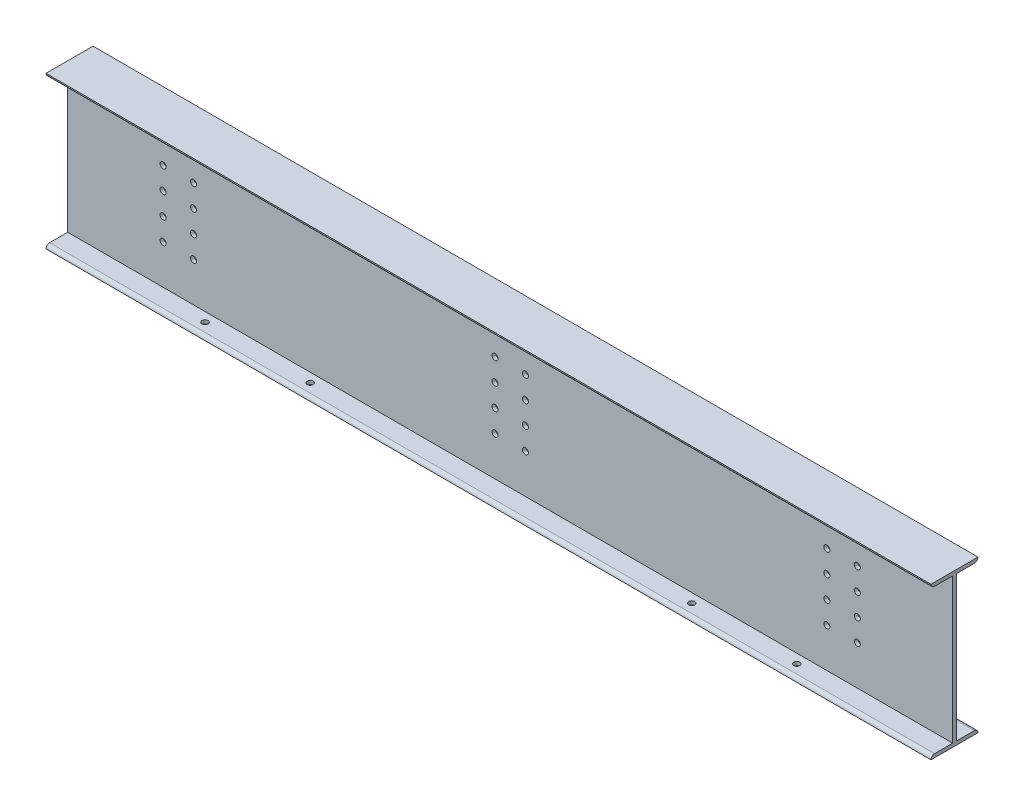
from build123d import *

# Parameters (mm, degrees)
SKETCH_1_W                        = 3200
SKETCH_1_H                        = 550
EXTRUDE_1_DEPTH                   = 170
SKETCH_2_R                        = 11
CUT_EXTRUDE_1_DEPTH               = 3252.368942461
PATTERN_LINEAR_1_COUNT            = 4
PATTERN_LINEAR_1_PITCH            = 80
PATTERN_LINEAR_1_COUNT_DIR2       = 2
PATTERN_LINEAR_1_PITCH_DIR2       = 110
PATTERN_LINEAR_2_COUNT            = 3
PATTERN_LINEAR_2_PITCH            = 1200
PATTERN_LINEAR_2_COPY_1_SKETCH_R  = 11
PATTERN_LINEAR_2_COPY_1_DEPTH     = 3252.368942461
PATTERN_LINEAR_2_COPY_2_SKETCH_R  = 11
PATTERN_LINEAR_2_COPY_2_DEPTH     = 3252.368942461
PATTERN_LINEAR_2_COPY_3_SKETCH_R  = 11
PATTERN_LINEAR_2_COPY_3_DEPTH     = 3252.368942461
PATTERN_LINEAR_2_COPY_4_SKETCH_R  = 11
PATTERN_LINEAR_2_COPY_4_DEPTH     = 3252.368942461
PATTERN_LINEAR_2_COPY_5_SKETCH_R  = 11
PATTERN_LINEAR_2_COPY_5_DEPTH     = 3252.368942461
PATTERN_LINEAR_2_COPY_6_SKETCH_R  = 11
PATTERN_LINEAR_2_COPY_6_DEPTH     = 3252.368942461
PATTERN_LINEAR_2_COPY_7_SKETCH_R  = 11
PATTERN_LINEAR_2_COPY_7_DEPTH     = 3252.368942461
PATTERN_LINEAR_2_COPY_8_SKETCH_R  = 11
PATTERN_LINEAR_2_COPY_8_DEPTH     = 3252.368942461
PATTERN_LINEAR_2_COPY_9_SKETCH_R  = 11
PATTERN_LINEAR_2_COPY_9_DEPTH     = 3252.368942461
PATTERN_LINEAR_2_COPY_10_SKETCH_R = 11
PATTERN_LINEAR_2_COPY_10_DEPTH    = 3252.368942461
PATTERN_LINEAR_2_COPY_11_SKETCH_R = 11
PATTERN_LINEAR_2_COPY_11_DEPTH    = 3252.368942461
PATTERN_LINEAR_2_COPY_12_SKETCH_R = 11
PATTERN_LINEAR_2_COPY_12_DEPTH    = 3252.368942461
PATTERN_LINEAR_2_COPY_13_SKETCH_R = 11
PATTERN_LINEAR_2_COPY_13_DEPTH    = 3252.368942461
PATTERN_LINEAR_2_COPY_14_SKETCH_R = 11
PATTERN_LINEAR_2_COPY_14_DEPTH    = 3252.368942461
SKETCH_3_R                        = 11
CUT_EXTRUDE_3_DEPTH               = 200
PATTERN_LINEAR_3_COUNT            = 2
PATTERN_LINEAR_3_PITCH            = 80
PATTERN_LINEAR_4_COUNT            = 2
PATTERN_LINEAR_4_PITCH            = 380
PATTERN_LINEAR_4_COPY_1_SKETCH_R  = 11
PATTERN_LINEAR_4_COPY_1_DEPTH     = 200
PATTERN_LINEAR_5_COUNT            = 2
PATTERN_LINEAR_5_PITCH            = 1760
PATTERN_LINEAR_5_COPY_1_SKETCH_R  = 11
PATTERN_LINEAR_5_COPY_1_DEPTH     = 200
PATTERN_LINEAR_5_COPY_2_SKETCH_R  = 11
PATTERN_LINEAR_5_COPY_2_DEPTH     = 200
PATTERN_LINEAR_5_COPY_3_SKETCH_R  = 11
PATTERN_LINEAR_5_COPY_3_DEPTH     = 200
SKETCH_4_W                        = 78.5
SKETCH_4_H                        = 524
CUT_EXTRUDE_4_DEPTH               = 3252.368942461
FILLET_1_R                        = 13
FILLET_2_R                        = 13
FILLET_3_R                        = 13
FILLET_4_R                        = 13


with BuildPart() as part:
    # 草图1 → 拉伸1 (new body)
    with BuildSketch(Plane.XY):
        with Locations((1600, 275)):
            Rectangle(SKETCH_1_W, SKETCH_1_H)
    extrude(amount=EXTRUDE_1_DEPTH)

    # 草图2 → 切除-拉伸1 (cut, through all)
    with BuildSketch(Plane.XY.offset(170)):
        with Locations((345, 155)):
            Circle(SKETCH_2_R)
    cut_extrude_1 = extrude(amount=-CUT_EXTRUDE_1_DEPTH, mode=Mode.SUBTRACT)

    # 阵列(线性)1: Cut-Extrude 1 4 × 2
    with Locations(*[(j * PATTERN_LINEAR_1_PITCH_DIR2, i * PATTERN_LINEAR_1_PITCH, 0) for i in range(PATTERN_LINEAR_1_COUNT) for j in range(PATTERN_LINEAR_1_COUNT_DIR2) if (i, j) != (0, 0)]):
        add(cut_extrude_1, mode=Mode.SUBTRACT)

    # 阵列(线性)2: 切除-拉伸1 ×3
    with Locations(*[(i * PATTERN_LINEAR_2_PITCH, 0, 0) for i in range(1, PATTERN_LINEAR_2_COUNT)]):
        add(cut_extrude_1, mode=Mode.SUBTRACT)

    # 阵列(线性)2 copy 1 sketch → 阵列(线性)2 copy 1 (cut, through all)
    with BuildSketch(Plane(origin=(1310, 0, 170), x_dir=(1, 0, 0), z_dir=(0, 0, 1))):
        with Locations((345, 155)):
            Circle(PATTERN_LINEAR_2_COPY_1_SKETCH_R)
    extrude(amount=-PATTERN_LINEAR_2_COPY_1_DEPTH, mode=Mode.SUBTRACT)

    # 阵列(线性)2 copy 2 sketch → 阵列(线性)2 copy 2 (cut, through all)
    with BuildSketch(Plane(origin=(2510, 0, 170), x_dir=(1, 0, 0), z_dir=(0, 0, 1))):
        with Locations((345, 155)):
            Circle(PATTERN_LINEAR_2_COPY_2_SKETCH_R)
    extrude(amount=-PATTERN_LINEAR_2_COPY_2_DEPTH, mode=Mode.SUBTRACT)

    # 阵列(线性)2 copy 3 sketch → 阵列(线性)2 copy 3 (cut, through all)
    with BuildSketch(Plane(origin=(1200, 80, 170), x_dir=(1, 0, 0), z_dir=(0, 0, 1))):
        with Locations((345, 155)):
            Circle(PATTERN_LINEAR_2_COPY_3_SKETCH_R)
    extrude(amount=-PATTERN_LINEAR_2_COPY_3_DEPTH, mode=Mode.SUBTRACT)

    # 阵列(线性)2 copy 4 sketch → 阵列(线性)2 copy 4 (cut, through all)
    with BuildSketch(Plane(origin=(2400, 80, 170), x_dir=(1, 0, 0), z_dir=(0, 0, 1))):
        with Locations((345, 155)):
            Circle(PATTERN_LINEAR_2_COPY_4_SKETCH_R)
    extrude(amount=-PATTERN_LINEAR_2_COPY_4_DEPTH, mode=Mode.SUBTRACT)

    # 阵列(线性)2 copy 5 sketch → 阵列(线性)2 copy 5 (cut, through all)
    with BuildSketch(Plane(origin=(1310, 80, 170), x_dir=(1, 0, 0), z_dir=(0, 0, 1))):
        with Locations((345, 155)):
            Circle(PATTERN_LINEAR_2_COPY_5_SKETCH_R)
    extrude(amount=-PATTERN_LINEAR_2_COPY_5_DEPTH, mode=Mode.SUBTRACT)

    # 阵列(线性)2 copy 6 sketch → 阵列(线性)2 copy 6 (cut, through all)
    with BuildSketch(Plane(origin=(2510, 80, 170), x_dir=(1, 0, 0), z_dir=(0, 0, 1))):
        with Locations((345, 155)):
            Circle(PATTERN_LINEAR_2_COPY_6_SKETCH_R)
    extrude(amount=-PATTERN_LINEAR_2_COPY_6_DEPTH, mode=Mode.SUBTRACT)

    # 阵列(线性)2 copy 7 sketch → 阵列(线性)2 copy 7 (cut, through all)
    with BuildSketch(Plane(origin=(1200, 160, 170), x_dir=(1, 0, 0), z_dir=(0, 0, 1))):
        with Locations((345, 155)):
            Circle(PATTERN_LINEAR_2_COPY_7_SKETCH_R)
    extrude(amount=-PATTERN_LINEAR_2_COPY_7_DEPTH, mode=Mode.SUBTRACT)

    # 阵列(线性)2 copy 8 sketch → 阵列(线性)2 copy 8 (cut, through all)
    with BuildSketch(Plane(origin=(2400, 160, 170), x_dir=(1, 0, 0), z_dir=(0, 0, 1))):
        with Locations((345, 155)):
            Circle(PATTERN_LINEAR_2_COPY_8_SKETCH_R)
    extrude(amount=-PATTERN_LINEAR_2_COPY_8_DEPTH, mode=Mode.SUBTRACT)

    # 阵列(线性)2 copy 9 sketch → 阵列(线性)2 copy 9 (cut, through all)
    with BuildSketch(Plane(origin=(1310, 160, 170), x_dir=(1, 0, 0), z_dir=(0, 0, 1))):
        with Locations((345, 155)):
            Circle(PATTERN_LINEAR_2_COPY_9_SKETCH_R)
    extrude(amount=-PATTERN_LINEAR_2_COPY_9_DEPTH, mode=Mode.SUBTRACT)

    # 阵列(线性)2 copy 10 sketch → 阵列(线性)2 copy 10 (cut, through all)
    with BuildSketch(Plane(origin=(2510, 160, 170), x_dir=(1, 0, 0), z_dir=(0, 0, 1))):
        with Locations((345, 155)):
            Circle(PATTERN_LINEAR_2_COPY_10_SKETCH_R)
    extrude(amount=-PATTERN_LINEAR_2_COPY_10_DEPTH, mode=Mode.SUBTRACT)

    # 阵列(线性)2 copy 11 sketch → 阵列(线性)2 copy 11 (cut, through all)
    with BuildSketch(Plane(origin=(1200, 240, 170), x_dir=(1, 0, 0), z_dir=(0, 0, 1))):
        with Locations((345, 155)):
            Circle(PATTERN_LINEAR_2_COPY_11_SKETCH_R)
    extrude(amount=-PATTERN_LINEAR_2_COPY_11_DEPTH, mode=Mode.SUBTRACT)

    # 阵列(线性)2 copy 12 sketch → 阵列(线性)2 copy 12 (cut, through all)
    with BuildSketch(Plane(origin=(2400, 240, 170), x_dir=(1, 0, 0), z_dir=(0, 0, 1))):
        with Locations((345, 155)):
            Circle(PATTERN_LINEAR_2_COPY_12_SKETCH_R)
    extrude(amount=-PATTERN_LINEAR_2_COPY_12_DEPTH, mode=Mode.SUBTRACT)

    # 阵列(线性)2 copy 13 sketch → 阵列(线性)2 copy 13 (cut, through all)
    with BuildSketch(Plane(origin=(1310, 240, 170), x_dir=(1, 0, 0), z_dir=(0, 0, 1))):
        with Locations((345, 155)):
            Circle(PATTERN_LINEAR_2_COPY_13_SKETCH_R)
    extrude(amount=-PATTERN_LINEAR_2_COPY_13_DEPTH, mode=Mode.SUBTRACT)

    # 阵列(线性)2 copy 14 sketch → 阵列(线性)2 copy 14 (cut, through all)
    with BuildSketch(Plane(origin=(2510, 240, 170), x_dir=(1, 0, 0), z_dir=(0, 0, 1))):
        with Locations((345, 155)):
            Circle(PATTERN_LINEAR_2_COPY_14_SKETCH_R)
    extrude(amount=-PATTERN_LINEAR_2_COPY_14_DEPTH, mode=Mode.SUBTRACT)

    # 草图3 → 切除-拉伸3 (cut)
    with BuildSketch(Plane.XZ):
        with Locations(Location((530, 45, 0), (0, 0, 270))):
            Circle(SKETCH_3_R)
    cut_extrude_3 = extrude(amount=-CUT_EXTRUDE_3_DEPTH, mode=Mode.SUBTRACT)

    # 阵列(线性)3: 切除-拉伸3 ×2
    with Locations(*[(0, 0, i * PATTERN_LINEAR_3_PITCH) for i in range(1, PATTERN_LINEAR_3_COUNT)]):
        add(cut_extrude_3, mode=Mode.SUBTRACT)

    # 阵列(线性)4: 切除-拉伸3 ×2
    with Locations(*[(i * PATTERN_LINEAR_4_PITCH, 0, 0) for i in range(1, PATTERN_LINEAR_4_COUNT)]):
        add(cut_extrude_3, mode=Mode.SUBTRACT)

    # 阵列(线性)4 copy 1 sketch → 阵列(线性)4 copy 1 (cut)
    with BuildSketch(Plane(origin=(380, 0, 80), x_dir=(1, 0, 0), z_dir=(0, -1, 0))):
        with Locations(Location((530, 45, 0), (0, 0, 270))):
            Circle(PATTERN_LINEAR_4_COPY_1_SKETCH_R)
    extrude(amount=-PATTERN_LINEAR_4_COPY_1_DEPTH, mode=Mode.SUBTRACT)

    # 阵列(线性)5: 切除-拉伸3 ×2
    with Locations(*[(i * PATTERN_LINEAR_5_PITCH, 0, 0) for i in range(1, PATTERN_LINEAR_5_COUNT)]):
        add(cut_extrude_3, mode=Mode.SUBTRACT)

    # 阵列(线性)5 copy 1 sketch → 阵列(线性)5 copy 1 (cut)
    with BuildSketch(Plane(origin=(1760, 0, 80), x_dir=(1, 0, 0), z_dir=(0, -1, 0))):
        with Locations(Location((530, 45, 0), (0, 0, 270))):
            Circle(PATTERN_LINEAR_5_COPY_1_SKETCH_R)
    extrude(amount=-PATTERN_LINEAR_5_COPY_1_DEPTH, mode=Mode.SUBTRACT)

    # 阵列(线性)5 copy 2 sketch → 阵列(线性)5 copy 2 (cut)
    with BuildSketch(Plane(origin=(2140, 0, 0), x_dir=(1, 0, 0), z_dir=(0, -1, 0))):
        with Locations(Location((530, 45, 0), (0, 0, 270))):
            Circle(PATTERN_LINEAR_5_COPY_2_SKETCH_R)
    extrude(amount=-PATTERN_LINEAR_5_COPY_2_DEPTH, mode=Mode.SUBTRACT)

    # 阵列(线性)5 copy 3 sketch → 阵列(线性)5 copy 3 (cut)
    with BuildSketch(Plane(origin=(2140, 0, 80), x_dir=(1, 0, 0), z_dir=(0, -1, 0))):
        with Locations(Location((530, 45, 0), (0, 0, 270))):
            Circle(PATTERN_LINEAR_5_COPY_3_SKETCH_R)
    extrude(amount=-PATTERN_LINEAR_5_COPY_3_DEPTH, mode=Mode.SUBTRACT)

    # 草图4 → 切除-拉伸4 (cut, through all)
    with BuildSketch(Plane.ZY):
        with Locations((39.25, 275)):
            Rectangle(SKETCH_4_W, SKETCH_4_H)
        with Locations((130.75, 275)):
            Rectangle(SKETCH_4_W, SKETCH_4_H)
    extrude(amount=-CUT_EXTRUDE_4_DEPTH, mode=Mode.SUBTRACT)

    # 圆角1
    fillet_1_edges = [part.edges().sort_by_distance(p)[0] for p in [
        (1600, 13, 170),
    ]]
    fillet(fillet_1_edges, radius=FILLET_1_R - 0.0001)  # a hair under: the kernel refuses the full size

    # 圆角2
    fillet_2_edges = [part.edges().sort_by_distance(p)[0] for p in [
        (1600, 13, 0),
    ]]
    fillet(fillet_2_edges, radius=FILLET_2_R - 0.0001)  # a hair under: the kernel refuses the full size

    # 圆角3
    fillet_3_edges = [part.edges().sort_by_distance(p)[0] for p in [
        (1600, 537, 170),
    ]]
    fillet(fillet_3_edges, radius=FILLET_3_R - 0.0001)  # a hair under: the kernel refuses the full size

    # 圆角4
    fillet_4_edges = [part.edges().sort_by_distance(p)[0] for p in [
        (1600, 537, 0),
    ]]
    fillet(fillet_4_edges, radius=FILLET_4_R - 0.0001)  # a hair under: the kernel refuses the full size


solid = part.part
